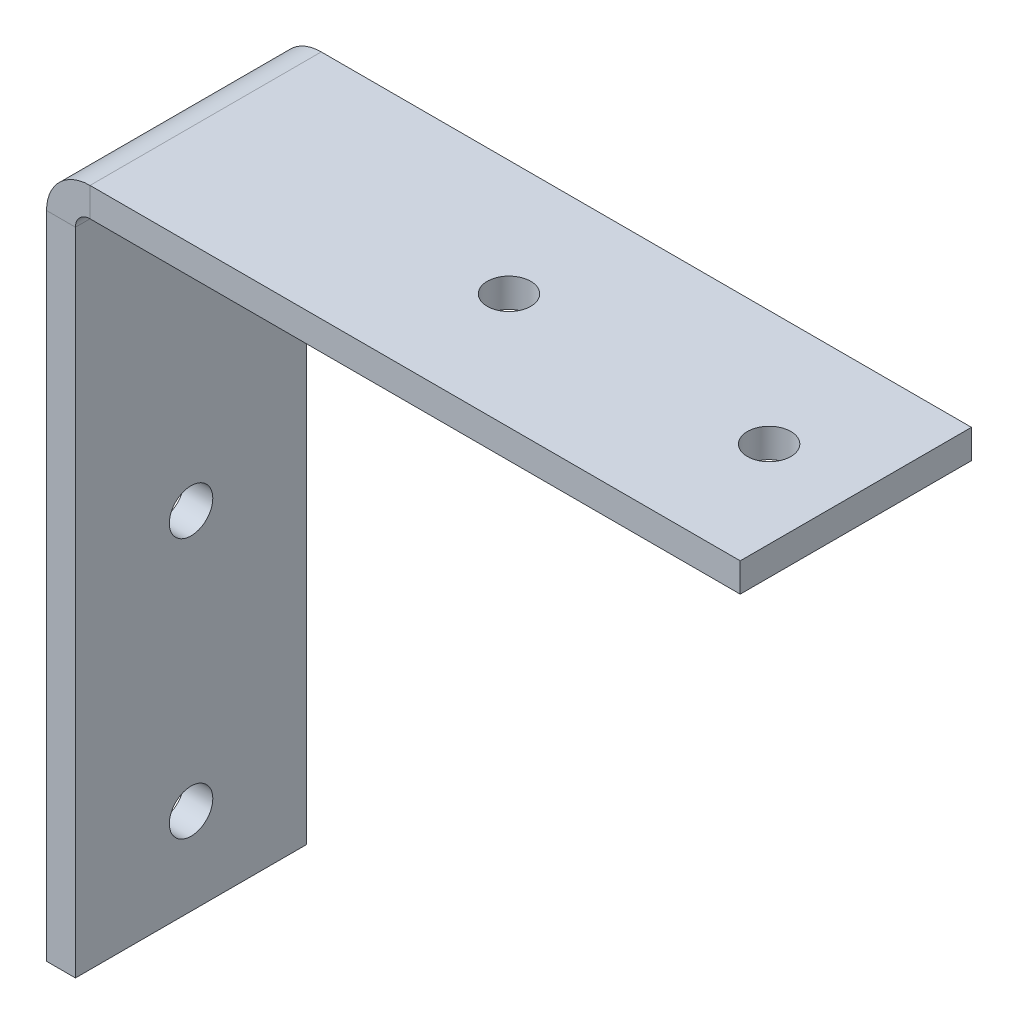
from build123d import *

# Parameters (mm, degrees)
BASE_FLANGE1_DEPTH = 25.4
SKETCH3_R          = 2.3876
CUT_EXTRUDE1_DEPTH = 5.08
SKETCH4_R          = 2.3876
CUT_EXTRUDE2_DEPTH = 5.08


# Sheet-metal steps are written as plain solids
with BuildPart() as part:
    # Sketch1 → Base-Flange1 (new body)
    with BuildSketch(Plane.XY):
        with BuildLine():
            Line((76.2, 0), (4.7752, 0))
            ThreePointArc((4.7752, 0), (1.398623698, -1.398623698), (0, -4.7752))
            Line((0, -4.7752), (0, -76.2))
            Line((0, -76.2), (3.175, -76.2))
            Line((3.175, -76.2), (3.175, -4.7752))
            ThreePointArc((3.175, -4.7752), (3.643687729, -3.643687729), (4.7752, -3.175))
            Line((4.7752, -3.175), (76.2, -3.175))
            Line((76.2, -3.175), (76.2, 0))
        make_face()
    extrude(amount=-BASE_FLANGE1_DEPTH)

    # Sketch3 → Cut-Extrude1 (cut)
    with BuildSketch(Plane(origin=(0, 0, 0), x_dir=(-1, 0, 0), z_dir=(0, 1, 0))):
        with Locations(Location((-66.675, -12.7, 0), (0, 0, 90))):
            Circle(SKETCH3_R)
        with Locations(Location((-38.1, -12.7, 0), (0, 0, 90))):
            Circle(SKETCH3_R)
    extrude(amount=-CUT_EXTRUDE1_DEPTH, mode=Mode.SUBTRACT)

    # Sketch4 → Cut-Extrude2 (cut)
    with BuildSketch(Plane.ZY):
        with Locations(Location((-12.7, -66.675, 0), (0, 0, 270))):
            Circle(SKETCH4_R)
        with Locations(Location((-12.7, -38.1, 0), (0, 0, 270))):
            Circle(SKETCH4_R)
    extrude(amount=-CUT_EXTRUDE2_DEPTH, mode=Mode.SUBTRACT)


solid = part.part
